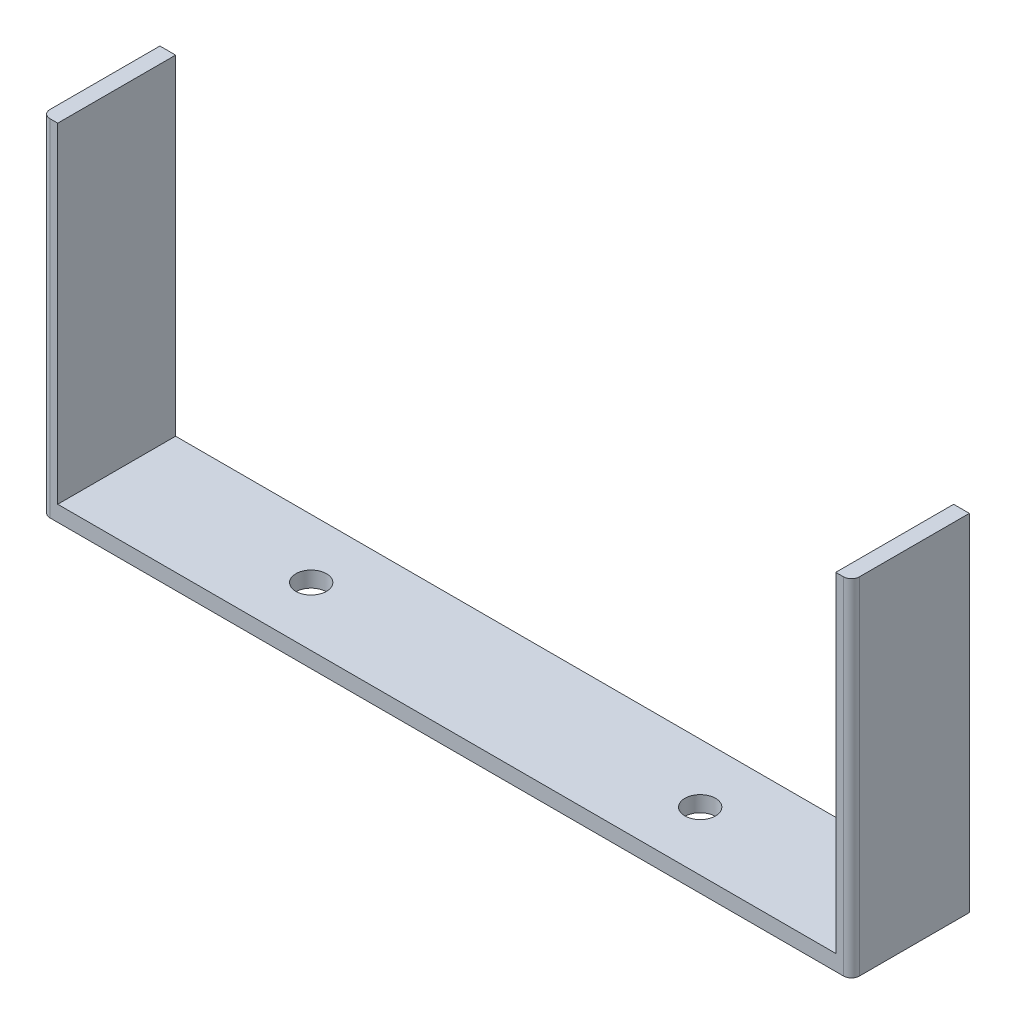
from build123d import *

# Parameters (mm, degrees)
ESBO_O1_W                = 103
ESBO_O1_H                = 15
RESSALTO_EXTRUS_O1_DEPTH = 2
ESBO_O2_W                = 2
ESBO_O2_H                = 15
RESSALTO_EXTRUS_O2_DEPTH = 42
ESBO_O4_R                = 1.95
CORTE_EXTRUS_O1_DEPTH    = 2
FILETE1_R                = 1


with BuildPart() as part:
    # Esboço1 → Ressalto-extrusão1 (new body)
    with BuildSketch(Plane(origin=(0, 0, 0), x_dir=(1, 0, 0), z_dir=(0, 1, 0))):
        Rectangle(ESBO_O1_W, ESBO_O1_H)
    extrude(amount=-RESSALTO_EXTRUS_O1_DEPTH)

    # Esboço2 → Ressalto-extrusão2 (add)
    with BuildSketch(Plane(origin=(0, 0, 0), x_dir=(1, 0, 0), z_dir=(0, 1, 0))):
        with Locations((-50.5, 0)):
            Rectangle(ESBO_O2_W, ESBO_O2_H)
        with Locations((50.5, 0)):
            Rectangle(ESBO_O2_W, ESBO_O2_H)
    extrude(amount=RESSALTO_EXTRUS_O2_DEPTH)

    # Esboço4 → Corte-extrusão1 (cut)
    with BuildSketch(Plane(origin=(0, 0, 0), x_dir=(1, 0, 0), z_dir=(0, 1, 0))):
        with Locations((24.75, 0)):
            Circle(ESBO_O4_R)
        with Locations((-24.75, 0)):
            Circle(ESBO_O4_R)
    extrude(amount=-CORTE_EXTRUS_O1_DEPTH, mode=Mode.SUBTRACT)

    # Filete1
    filete1_edges = [part.edges().sort_by_distance(p)[0] for p in [
        (51.5, 20, 7.5),
        (-51.5, 20, 7.5),
    ]]
    fillet(filete1_edges, radius=FILETE1_R)


solid = part.part
